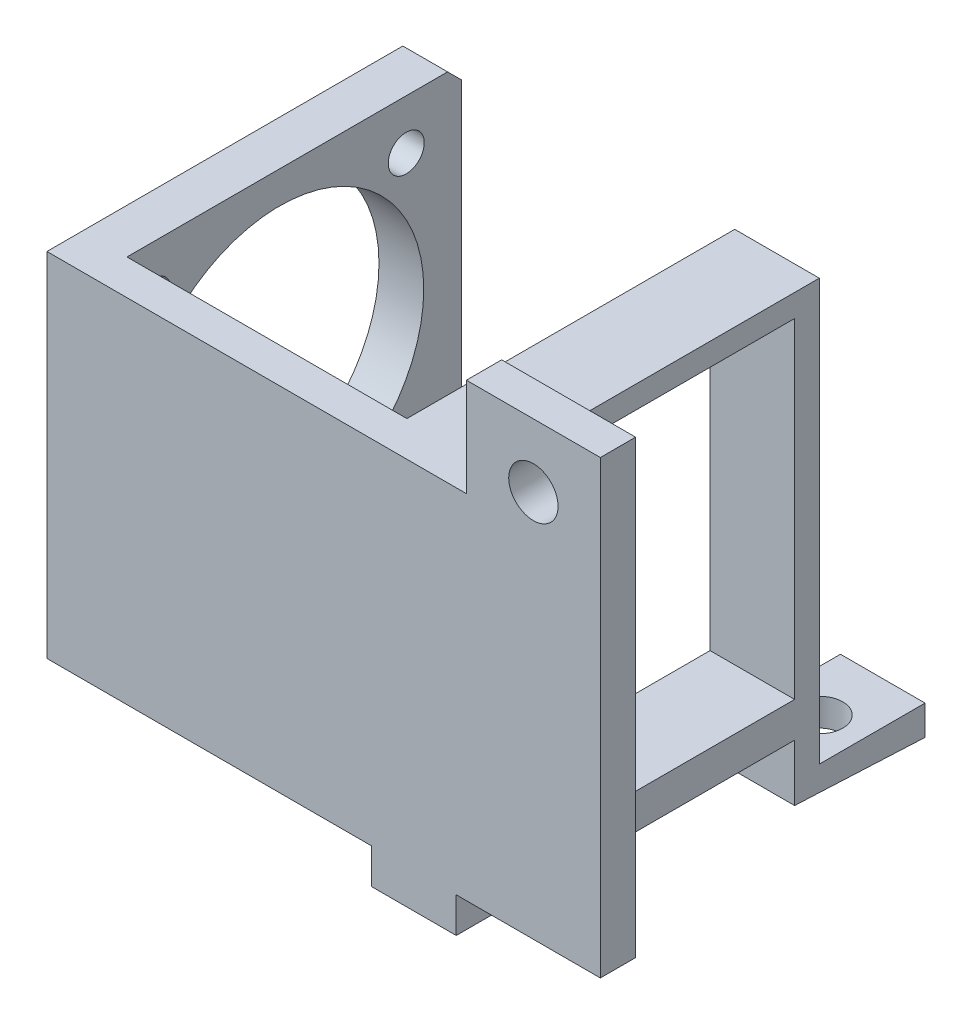
from build123d import *

# Parameters (mm, degrees)
BOSS_EXTRUDE1_DEPTH   = 5
SKETCH2_W             = 6.35
SKETCH2_H             = 50
BOSS_EXTRUDE2_DEPTH   = 52.48
CUT_EXTRUDE1_REACH    = 111.834
SKETCH3_R             = 20.44
SKETCH3_R_2           = 2.555
SKETCH3_W             = 5
SKETCH3_H             = 50
CUT_EXTRUDE2_REACH    = 113.895
SKETCH4_R             = 3.5
CUT_EXTRUDE6_REACH    = 113.895
SKETCH14_W            = 19
SKETCH14_H            = 15.316152196
SKETCH15_W            = 12
SKETCH15_H            = 3.2
BOSS_EXTRUDE7_DEPTH   = 46.5
BOSS_EXTRUDE8_REACH   = 107.356
SKETCH16_W            = 12
SKETCH16_H            = 3.5
SKETCH17_W            = 12
SKETCH17_H            = 3.5
BOSS_EXTRUDE9_DEPTH   = 15
CHAMFER2_SIZE         = 2
SKETCH22_W            = 12
SKETCH22_H            = 15
BOSS_EXTRUDE10_DEPTH  = 0.72
CUT_EXTRUDE8_REACH    = 108.012
CUT_EXTRUDE7_REACH    = 125.963
SKETCH18_R            = 3.25
CIRPATTERN2_COUNT     = 2
CIRPATTERN2_ANGLE     = 90
BOSS_EXTRUDE11_REACH  = 120.448
SKETCH24_W            = 12
SKETCH24_H            = 5
MIRROR3_OUTLINE_W     = 50
MIRROR3_OUTLINE_H     = 5
MIRROR3_DEPTH         = 78.5
MIRROR3_START         = 46.06
MIRROR3_2_DEPTH       = 12
MIRROR3_3_OUTLINE_R   = 2.555
MIRROR3_3_OUTLINE_R_2 = 20.44
MIRROR3_3_DEPTH       = 6.35
MIRROR3_START_2       = 59.5
MIRROR3_4_OUTLINE_W   = 13.938985111
MIRROR3_4_OUTLINE_H   = 5
MIRROR3_4_DEPTH       = 19
SKETCH25_W            = 96.13649257
SKETCH25_H            = 80.279562919
CUT_EXTRUDE9_DEPTH    = 138.879480059


with BuildPart() as part:
    # Sketch1 → Boss-Extrude1 (new body)
    with BuildSketch(Plane.XY):
        Polygon((0, 0), (0, 50), (46.06, 50), (46.06, 55), (58.06, 55), (58.06, 50), (59.5, 50), (59.5, 64.061014889), (78.5, 64.061014889), (78.5, -13.938985111), (59.5, -13.938985111), (59.5, 0), align=None)
    extrude(amount=BOSS_EXTRUDE1_DEPTH)

    # Sketch2 → Boss-Extrude2 (add)
    with BuildSketch(Plane(origin=(0, 0, 0), x_dir=(-1, 0, 0), z_dir=(0, 0, -1))):
        with Locations((-3.175, 25)):
            Rectangle(SKETCH2_W, SKETCH2_H)
    extrude(amount=BOSS_EXTRUDE2_DEPTH)

    # Sketch3 → Cut-Extrude1 (cut, up to next)
    with BuildSketch(Plane(origin=(6.35, 0, 0), x_dir=(0, 0, -1), z_dir=(1, 0, 0)), mode=Mode.PRIVATE) as cut_extrude1_sk1:
        with Locations((21.66, 25)):
            Circle(SKETCH3_R)
    cut_extrude1_tool1 = extrude(cut_extrude1_sk1.sketch, amount=-CUT_EXTRUDE1_REACH, mode=Mode.PRIVATE) & part.part
    # Sketch3 → Cut-Extrude1 (cut, up to next)
    with BuildSketch(Plane(origin=(6.35, 0, 0), x_dir=(0, 0, -1), z_dir=(1, 0, 0)), mode=Mode.PRIVATE) as cut_extrude1_sk2:
        with Locations((3.695, 42.955)):
            Circle(SKETCH3_R_2)
    cut_extrude1_tool2 = extrude(cut_extrude1_sk2.sketch, amount=-CUT_EXTRUDE1_REACH, mode=Mode.PRIVATE) & part.part
    # Sketch3 → Cut-Extrude1 (cut, up to next)
    with BuildSketch(Plane(origin=(6.35, 0, 0), x_dir=(0, 0, -1), z_dir=(1, 0, 0)), mode=Mode.PRIVATE) as cut_extrude1_sk3:
        with Locations((39.615, 7.045)):
            Circle(SKETCH3_R_2)
    cut_extrude1_tool3 = extrude(cut_extrude1_sk3.sketch, amount=-CUT_EXTRUDE1_REACH, mode=Mode.PRIVATE) & part.part
    # Sketch3 → Cut-Extrude1 (cut, up to next)
    with BuildSketch(Plane(origin=(6.35, 0, 0), x_dir=(0, 0, -1), z_dir=(1, 0, 0)), mode=Mode.PRIVATE) as cut_extrude1_sk4:
        with Locations((49.98, 25)):
            Rectangle(SKETCH3_W, SKETCH3_H)
    cut_extrude1_tool4 = extrude(cut_extrude1_sk4.sketch, amount=-CUT_EXTRUDE1_REACH, mode=Mode.PRIVATE) & part.part
    cut_extrude1_1 = cut_extrude1_tool1.solids().sort_by_distance((6.35, 25, -21.66))[0]
    add(cut_extrude1_1, mode=Mode.SUBTRACT)
    cut_extrude1_2 = cut_extrude1_tool2.solids().sort_by_distance((6.35, 42.955, -3.695))[0]
    add(cut_extrude1_2, mode=Mode.SUBTRACT)
    cut_extrude1_3 = cut_extrude1_tool3.solids().sort_by_distance((6.35, 7.045, -39.615))[0]
    add(cut_extrude1_3, mode=Mode.SUBTRACT)
    cut_extrude1_4 = cut_extrude1_tool4.solids().sort_by_distance((6.35, 25, -49.98))[0]
    add(cut_extrude1_4, mode=Mode.SUBTRACT)
    cut_extrude1 = cut_extrude1_1 + cut_extrude1_2 + cut_extrude1_3 + cut_extrude1_4  # Cut-Extrude1 as one shape, for the pattern or mirror that repeats it

    # Sketch4 → Cut-Extrude2 (cut, up to next)
    with BuildSketch(Plane(origin=(0, 0, 0), x_dir=(-1, 0, 0), z_dir=(0, 0, -1)), mode=Mode.PRIVATE) as cut_extrude2_sk1:
        with Locations((-69, 55.061014889)):
            Circle(SKETCH4_R)
    cut_extrude2_tool1 = extrude(cut_extrude2_sk1.sketch, amount=-CUT_EXTRUDE2_REACH, mode=Mode.PRIVATE) & part.part
    # Sketch4 → Cut-Extrude2 (cut, up to next)
    with BuildSketch(Plane(origin=(0, 0, 0), x_dir=(-1, 0, 0), z_dir=(0, 0, -1)), mode=Mode.PRIVATE) as cut_extrude2_sk2:
        with Locations((-69, -4.938985111)):
            Circle(SKETCH4_R)
    cut_extrude2_tool2 = extrude(cut_extrude2_sk2.sketch, amount=-CUT_EXTRUDE2_REACH, mode=Mode.PRIVATE) & part.part
    add(cut_extrude2_tool1.solids().sort_by_distance((69, 55.061015, 0))[0], mode=Mode.SUBTRACT)
    add(cut_extrude2_tool2.solids().sort_by_distance((69, -4.938985, 0))[0], mode=Mode.SUBTRACT)

    # Sketch14 → Cut-Extrude6 (cut, up to next)
    with BuildSketch(Plane(origin=(0, 0, 0), x_dir=(-1, 0, 0), z_dir=(0, 0, -1)), mode=Mode.PRIVATE) as cut_extrude6_sk1:
        with Locations((-69, 57.658076098)):
            Rectangle(SKETCH14_W, SKETCH14_H)
    cut_extrude6_tool1 = extrude(cut_extrude6_sk1.sketch, amount=-CUT_EXTRUDE6_REACH, mode=Mode.PRIVATE) & part.part
    add(cut_extrude6_tool1.solids().sort_by_distance((69, 57.658076, 0))[0], mode=Mode.SUBTRACT)

    # Sketch15 → Boss-Extrude7 (add)
    with BuildSketch(Plane(origin=(0, 0, 0), x_dir=(-1, 0, 0), z_dir=(0, 0, -1))):
        with Locations((-52.06, 1.6)):
            Rectangle(SKETCH15_W, SKETCH15_H)
    extrude(amount=BOSS_EXTRUDE7_DEPTH)

    # Boss-Extrude8: up to this plane
    boss_extrude8_end = Plane(origin=(166.832994776, 64.085435133, -66.619565524), z_dir=(-1.1416993347548052e-15, 0.9990256874715413, 0.04413247978546202))
    # Sketch16 → Boss-Extrude8 (add, up to the surface)
    with BuildSketch(Plane(origin=(0, 3.2, 0), x_dir=(1, 0, 0), z_dir=(0, 1, 0)), mode=Mode.PRIVATE) as boss_extrude8_sk1:
        with Locations((52.06, 44.75)):
            Rectangle(SKETCH16_W, SKETCH16_H)
    boss_extrude8_tool1 = split(extrude(boss_extrude8_sk1.sketch, amount=BOSS_EXTRUDE8_REACH, mode=Mode.PRIVATE), bisect_by=boss_extrude8_end, keep=Keep.BOTH, mode=Mode.PRIVATE)
    add(boss_extrude8_tool1.solids().sort_by_distance((52.06, 3.2, -44.75))[0])

    # Sketch17 → Boss-Extrude9 (add)
    with BuildSketch(Plane(origin=(0, 0, -46.5), x_dir=(-1, 0, 0), z_dir=(0, 0, -1))):
        with Locations((-52.06, 61.446642853)):
            Rectangle(SKETCH17_W, SKETCH17_H)
    extrude(amount=BOSS_EXTRUDE9_DEPTH)

    # Chamfer2
    chamfer2_edges = [part.edges().sort_by_distance(p)[0] for p in [
        (3.175, 0, -47.48),
        (3.175, 50, -47.48),
    ]]
    chamfer(chamfer2_edges, length=CHAMFER2_SIZE)

    # Sketch22 → Boss-Extrude10 (add)
    with BuildSketch(Plane(origin=(0, 63.196642853, 0), x_dir=(1, 0, 0), z_dir=(0, 1, 0))):
        with Locations((52.06, 54)):
            Rectangle(SKETCH22_W, SKETCH22_H)
    extrude(amount=BOSS_EXTRUDE10_DEPTH)

    # Sketch23 → Cut-Extrude8 (cut, up to next)
    with BuildSketch(Plane(origin=(58.06, 0, 0), x_dir=(0, 0, -1), z_dir=(1, 0, 0)), mode=Mode.PRIVATE) as cut_extrude8_sk1:
        Polygon((46.5, 63.916642853), (46.5, 63.196642853), (61.5, 63.916642853), align=None)
    cut_extrude8_tool1 = extrude(cut_extrude8_sk1.sketch, amount=-CUT_EXTRUDE8_REACH, mode=Mode.PRIVATE) & part.part
    add(cut_extrude8_tool1.solids().sort_by_distance((58.06, 63.676643, -51.5))[0], mode=Mode.SUBTRACT)

    # Cut-Extrude7: up to this plane
    cut_extrude7_end = Plane(origin=(-0.001, 63.196642853, -46.5), z_dir=(-2.1659106514416256e-15, -0.9988499868416298, -0.04794479936839813))
    # Sketch18 → Cut-Extrude7 (cut, up to the surface)
    with BuildSketch(Plane.XZ.offset(-59.696642853), mode=Mode.PRIVATE) as cut_extrude7_sk1:
        with Locations(Location((52.06, -52.57, 0), (0, 0, 270))):
            Circle(SKETCH18_R)
    cut_extrude7_tool1 = split(extrude(cut_extrude7_sk1.sketch, amount=-CUT_EXTRUDE7_REACH, mode=Mode.PRIVATE), bisect_by=cut_extrude7_end, keep=Keep.BOTH, mode=Mode.PRIVATE)
    add(cut_extrude7_tool1.solids().sort_by_distance((52.06, 59.696643, -52.57))[0], mode=Mode.SUBTRACT)

    # CirPattern2: Cut-Extrude1 ×2 about axis
    cirpattern2_axis = Axis((0, 25, -21.66), (-1, 0, 0))
    for i in range(1, CIRPATTERN2_COUNT):
        add(cut_extrude1.rotate(cirpattern2_axis, i * CIRPATTERN2_ANGLE / (CIRPATTERN2_COUNT - 1)), mode=Mode.SUBTRACT)

    # Sketch24 → Boss-Extrude11 (add, up to next)
    with BuildSketch(Plane(origin=(0, 0, 0), x_dir=(-1, 0, 0), z_dir=(0, 0, -1)), mode=Mode.PRIVATE) as boss_extrude11_sk1:
        with Locations((-52.06, 52.5)):
            Rectangle(SKETCH24_W, SKETCH24_H)
    boss_extrude11_tool1 = extrude(boss_extrude11_sk1.sketch, amount=BOSS_EXTRUDE11_REACH, mode=Mode.PRIVATE) - part.part
    add(boss_extrude11_tool1.solids().sort_by_distance((52.06, 52.5, 0))[0])



with BuildPart() as body_2:
    # Mirror3: read off the stored shape, not the designer's step
    # Mirror3 outline → Mirror3 (new body)
    with BuildSketch(Plane.YZ):
        with Locations((-52.877970222, 2.5)):
            Rectangle(MIRROR3_OUTLINE_W, MIRROR3_OUTLINE_H)
    extrude(amount=MIRROR3_DEPTH)

    # Mirror3 2 outline → Mirror3 2 (add)
    with BuildSketch(Plane.YZ.offset(MIRROR3_START)):
        Polygon((-77.877970222, -43), (-77.877970222, 5), (-82.877970222, 5), (-82.877970222, -43), (-90.919998753, -43), (-91.074613075, -46.5), (-91.794613075, -61.5), (-87.574613075, -61.5), (-87.574613075, -46.5), (-27.877970222, -46.5), (-27.877970222, 0), (-31.077970222, 0), (-31.077970222, -43), align=None)
    extrude(amount=MIRROR3_2_DEPTH)

    # Mirror3 3 outline → Mirror3 3 (add)
    with BuildSketch(Plane.YZ):
        Polygon((-77.877970222, 0), (-77.877970222, -45.48), (-75.877970222, -47.48), (-29.877970222, -47.48), (-27.877970222, -45.48), (-27.877970222, 0), align=None)
        with Locations((-70.842970222, -39.615)):
            Circle(MIRROR3_3_OUTLINE_R, mode=Mode.SUBTRACT)
        with Locations((-34.922970222, -39.615)):
            Circle(MIRROR3_3_OUTLINE_R, mode=Mode.SUBTRACT)
        with Locations((-52.877970222, -21.66)):
            Circle(MIRROR3_3_OUTLINE_R_2, mode=Mode.SUBTRACT)
        with Locations((-70.832970222, -3.695)):
            Circle(MIRROR3_3_OUTLINE_R, mode=Mode.SUBTRACT)
        with Locations((-34.922970222, -3.705)):
            Circle(MIRROR3_3_OUTLINE_R, mode=Mode.SUBTRACT)
    extrude(amount=MIRROR3_3_DEPTH)


with BuildPart() as part_1:
    add(part.part)

    add(body_2.part)  # Mirror3 4 merges body 2
    # Mirror3 4 outline → Mirror3 4 (add)
    with BuildSketch(Plane.YZ.offset(MIRROR3_START_2)):
        with Locations((-20.908477667, 2.5)):
            Rectangle(MIRROR3_4_OUTLINE_W, MIRROR3_4_OUTLINE_H)
    extrude(amount=MIRROR3_4_DEPTH)

    # Mirror3 5: loft between two sections, ruled curve by curve
    mirror3_5_from = [
        Edge.make_three_point_arc((52.06, -91.521973075, -55.82), (48.81, -91.521973075, -52.57), (52.06, -91.521973075, -49.32)),
        Edge.make_three_point_arc((52.06, -91.521973075, -49.32), (55.31, -91.521973075, -52.57), (52.06, -91.521973075, -55.82)),
    ]
    mirror3_5_to = [
        Edge.make_three_point_arc((52.06, -87.574613075, -55.82), (48.81, -87.574613075, -52.57), (52.06, -87.574613075, -49.32)),
        Edge.make_three_point_arc((52.06, -87.574613075, -49.32), (55.31, -87.574613075, -52.57), (52.06, -87.574613075, -55.82)),
    ]
    mirror3_5 = Solid(Shell([*[Face.make_surface_from_curves(mirror3_5_from[k], mirror3_5_to[k]) for k in range(2)], Face(Wire(mirror3_5_from)), Face(Wire(mirror3_5_to))]))
    add(mirror3_5, mode=Mode.SUBTRACT)

    # Mirror3 6: loft between two sections, ruled curve by curve
    mirror3_6_from = [
        Edge.make_three_point_arc((65.5, -22.938985111, 5), (69, -19.438985111, 5), (72.5, -22.938985111, 5)),
        Edge.make_three_point_arc((72.5, -22.938985111, 5), (69, -26.438985111, 5), (65.5, -22.938985111, 5)),
    ]
    mirror3_6_to = [
        Edge.make_three_point_arc((65.5, -22.938985111, 0), (69, -19.438985111, 0), (72.5, -22.938985111, 0)),
        Edge.make_three_point_arc((72.5, -22.938985111, 0), (69, -26.438985111, 0), (65.5, -22.938985111, 0)),
    ]
    mirror3_6 = Solid(Shell([*[Face.make_surface_from_curves(mirror3_6_from[k], mirror3_6_to[k]) for k in range(2)], Face(Wire(mirror3_6_from)), Face(Wire(mirror3_6_to))]))
    add(mirror3_6, mode=Mode.SUBTRACT)

    # Sketch25 → Cut-Extrude9 (cut, through all)
    with BuildSketch(Plane.XY.offset(5)):
        with Locations((30.431753715, 26.200796349)):
            Rectangle(SKETCH25_W, SKETCH25_H)
    extrude(amount=-CUT_EXTRUDE9_DEPTH, mode=Mode.SUBTRACT)


solid = part_1.part
